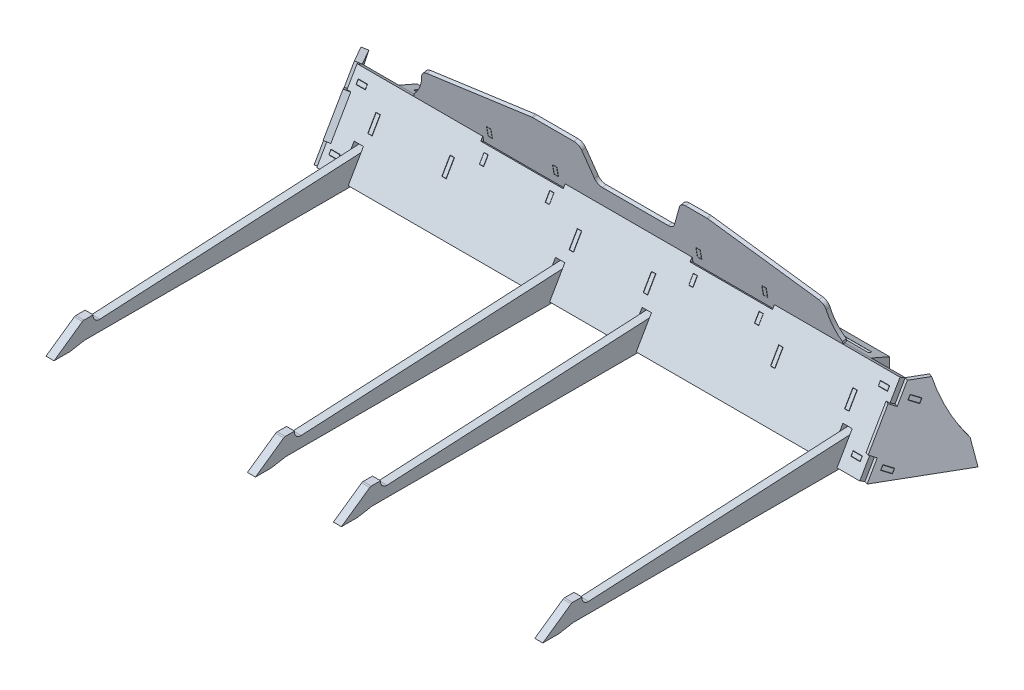
from build123d import *

# Parameters (mm, degrees)
BOSS_EXTRUDE1_DEPTH         = 214
SKETCH57_W                  = 3.02
SKETCH57_H                  = 31.755
SKETCH57_W_2                = 65
SKETCH57_H_2                = 3.02
CUT_EXTRUDE9_DEPTH          = 221.797815225
BOSS_EXTRUDE2_DEPTH         = 214
CUT_EXTRUDE1_DEPTH          = 236.113881398
BOSS_EXTRUDE31_REACH        = 224.119
SKETCH62_W                  = 64.6698
SKETCH62_H                  = 3.02
CUT_EXTRUDE11_DEPTH         = 281.495374193
CUT_EXTRUDE14_DEPTH         = 236.113881398
FILLET8_R                   = 6
BOSS_EXTRUDE4_DEPTH         = 27.5
CUT_EXTRUDE3_START          = 20.5
SKETCH1_10_W                = 3.175
SKETCH1_10_H                = 18
CUT_EXTRUDE3_DEPTH          = 15
CUT_EXTRUDE4_DEPTH          = 9
CUT_EXTRUDE4_DEPTH_BACK     = 198.869906117
CUT_EXTRUDE4_START          = -37.576497
SKETCH29_W                  = 41
SKETCH29_H                  = 3.175
BOSS_EXTRUDE13_DEPTH        = 3.02
ADVANCEDHOLE1_START         = -26.078544809
ADVANCEDHOLE1_OUTLINE_R     = 4.9022
ADVANCEDHOLE1_DEPTH         = 3.02
ADVANCEDHOLE1_START_2       = -32.928544809
ADVANCEDHOLE1_2_OUTLINE_R   = 4.1021
ADVANCEDHOLE1_2_DEPTH       = 23.233
ADVANCEDHOLE1_3_OUTLINE_R   = 4.9022
ADVANCEDHOLE1_3_OUTLINE_R_2 = 4.1021
ADVANCEDHOLE1_3_DEPTH       = 6.85
CUT_EXTRUDE5_START          = -10.025
CUT_EXTRUDE5_DEPTH          = 6.5
SKETCH35_R                  = 4.8125
CUT_EXTRUDE6_DEPTH          = 261.693802651
BOSS_EXTRUDE14_START        = 0.2
BOSS_EXTRUDE14_DEPTH        = 3.02
SKETCH37_R                  = 4.8025
CUT_EXTRUDE7_DEPTH          = 264.679515967
SKETCH72_W                  = 3.528
SKETCH72_H                  = 13.0302
CUT_EXTRUDE16_DEPTH         = 235.796866397
MIRROR22_COPY_1_SKETCH_W    = 3.528
MIRROR22_COPY_1_SKETCH_H    = 13.0302
MIRROR22_COPY_1_DEPTH       = 235.796866397
MIRROR23_COPY_1_SKETCH_W    = 3.528
MIRROR23_COPY_1_SKETCH_H    = 13.0302
MIRROR23_COPY_1_DEPTH       = 235.796866397
SKETCH53_R                  = 4.8025
BOSS_EXTRUDE20_DEPTH        = 6.35
SKETCH70_W                  = 7.35
SKETCH70_H                  = 24
CUT_EXTRUDE15_DEPTH         = 331.682625828
FILLET6_R                   = 5
FILLET6_R_2                 = 2
BOSS_EXTRUDE3_DEPTH         = 4.75
BOSS_EXTRUDE33_REACH        = 453.171
SKETCH64_W                  = 4.75
SKETCH64_H                  = 31.4248
CUT_EXTRUDE12_DEPTH         = 372.648131316
SKETCH39_W                  = 7
SKETCH39_H                  = 4.75
BOSS_EXTRUDE35_DEPTH        = 3.02
FILLET7_R                   = 25
CUT_EXTRUDE13_START         = -3.274
SKETCH68_W                  = 7.3302
SKETCH68_H                  = 5.0802
CUT_EXTRUDE13_DEPTH         = 3.528
MIRROR28_START              = -3.274
MIRROR28_COPY_1_SKETCH_W    = 7.3302
MIRROR28_COPY_1_SKETCH_H    = 5.0802
MIRROR28_COPY_1_DEPTH       = 3.528
BOSS_EXTRUDE38_DEPTH        = 3.02
FILLET9_R                   = 5
SKETCH74_W                  = 3.401
SKETCH74_H                  = 7.3302
CUT_EXTRUDE17_DEPTH         = 356.008620676
MIRROR33_COPY_1_SKETCH_W    = 3.401
MIRROR33_COPY_1_SKETCH_H    = 7.3302
MIRROR33_COPY_1_DEPTH       = 356.008620676
SKETCH75_W                  = 3.528
SKETCH75_H                  = 7.3302
CUT_EXTRUDE18_DEPTH         = 380.8760238
MIRROR35_COPY_1_SKETCH_W    = 3.528
MIRROR35_COPY_1_SKETCH_H    = 7.3302
MIRROR35_COPY_1_DEPTH       = 380.8760238


with BuildPart() as part:
    # Sketch1 → Boss-Extrude1 (new, symmetric)
    with BuildSketch(Plane(origin=(0, 0, 0), x_dir=(0, 0, -1), z_dir=(1, 0, 0))):
        Polygon((-14.318286676, -4.8), (17.43597813, 50.2), (13.322357462, 52.575), (-18.431907344, -2.425), align=None)
    extrude(amount=BOSS_EXTRUDE1_DEPTH, both=True)

    # Sketch57 → Cut-Extrude9 (cut, through all)
    with BuildSketch(Plane(origin=(0, 7.375, 12.773874706), x_dir=(1, 0, 0), z_dir=(0, 0.49999999999999756, 0.86602540378444))):
        with Locations((212.49, 20.438199529)):
            Rectangle(SKETCH57_W, SKETCH57_H)
        with Locations((82.5, 50.682464335)):
            Rectangle(SKETCH57_W_2, SKETCH57_H_2)
    cut_extrude9 = extrude(amount=-CUT_EXTRUDE9_DEPTH, mode=Mode.SUBTRACT)

    # Mirror18: Cut-Extrude9 across plane
    add(cut_extrude9.mirror(Plane(origin=(0, 0, 0), x_dir=(0, 0, 1), z_dir=(1, 0, 0))), mode=Mode.SUBTRACT)

    # Sketch72 → Cut-Extrude16 (cut, through all)
    with BuildSketch(Plane(origin=(0, 7.375, 12.773874706), x_dir=(1, 0, 0), z_dir=(0, 0.4999999999999976, 0.86602540378444))):
        with Locations((29.21, 26.891241941)):
            Rectangle(SKETCH72_W, SKETCH72_H)
    cut_extrude16 = extrude(amount=-CUT_EXTRUDE16_DEPTH, mode=Mode.SUBTRACT)

    # Mirror20: Cut-Extrude16 across plane
    add(cut_extrude16.mirror(Plane(origin=(0, 0, 0), x_dir=(0, 0, 1), z_dir=(1, 0, 0))), mode=Mode.SUBTRACT)

    # Mirror22: Cut-Extrude16 across plane
    add(cut_extrude16.mirror(Plane(origin=(-79.375, 0, 0), x_dir=(0, 0, 1), z_dir=(1, 0, 0))), mode=Mode.SUBTRACT)

    # Mirror22 copy 1 sketch → Mirror22 copy 1 (cut, through all)
    with BuildSketch(Plane(origin=(-158.75, 7.375, 12.773874706), x_dir=(1, 0, 0), z_dir=(0, 0.4999999999999976, 0.86602540378444))):
        with Locations((29.21, 26.891241941)):
            Rectangle(MIRROR22_COPY_1_SKETCH_W, MIRROR22_COPY_1_SKETCH_H)
    extrude(amount=-MIRROR22_COPY_1_DEPTH, mode=Mode.SUBTRACT)

    # Mirror23: Cut-Extrude16 across plane
    add(cut_extrude16.mirror(Plane(origin=(79.375, 0, 0), x_dir=(0, 0, 1), z_dir=(1, 0, 0))), mode=Mode.SUBTRACT)

    # Mirror23 copy 1 sketch → Mirror23 copy 1 (cut, through all)
    with BuildSketch(Plane(origin=(158.75, 7.375, 12.773874706), x_dir=(1, 0, 0), z_dir=(0, 0.4999999999999976, 0.86602540378444))):
        with Locations((29.21, 26.891241941)):
            Rectangle(MIRROR23_COPY_1_SKETCH_W, MIRROR23_COPY_1_SKETCH_H)
    extrude(amount=-MIRROR23_COPY_1_DEPTH, mode=Mode.SUBTRACT)

    # Sketch70 → Cut-Extrude15 (cut, through all)
    with BuildSketch(Plane(origin=(0, 7.375, 12.773874706), x_dir=(1, 0, 0), z_dir=(0, 0.4999999999999977, 0.8660254037844402))):
        with Locations((34.145, 0.683934724)):
            Rectangle(SKETCH70_W, SKETCH70_H)
    cut_extrude15 = extrude(amount=-CUT_EXTRUDE15_DEPTH, mode=Mode.SUBTRACT)

    # Mirror15: Cut-Extrude15 across plane
    add(cut_extrude15.mirror(Plane(origin=(0, 0, 0), x_dir=(0, 0, 1), z_dir=(1, 0, 0))), mode=Mode.SUBTRACT)

    # Mirror16: Cut-Extrude15 across plane
    add(cut_extrude15.mirror(Plane(origin=(-79.375, 0, 0), x_dir=(0, 0, 1), z_dir=(1, 0, 0))), mode=Mode.SUBTRACT)

    # Mirror17: Cut-Extrude15 across plane
    add(cut_extrude15.mirror(Plane(origin=(113.27, 0, 0), x_dir=(0, 0, 1), z_dir=(1, 0, 0))), mode=Mode.SUBTRACT)


with BuildPart() as body_2:
    # Sketch1<4> → Boss-Extrude2 (new body)
    with BuildSketch(Plane(origin=(0, 0, 0), x_dir=(0, 0, -1), z_dir=(1, 0, 0))):
        Polygon((13.322357462, 52.575), (16.296476876, 53.099417497), (9.350549769, 92.491727617), (6.376430355, 91.96731012), align=None)
    extrude(amount=BOSS_EXTRUDE2_DEPTH)

    # Sketch2 → Cut-Extrude1 (cut, through all)
    with BuildSketch(Plane(origin=(0, 3.863587535, -21.911493747), x_dir=(1, 0, 0), z_dir=(0, -0.17364817766693463, 0.9848077530122075))):
        with BuildLine():
            Line((214, 89.462864519), (69, 89.462864519))
            Line((69, 89.462864519), (159, 74.462864519))
            ThreePointArc((159, 74.462864519), (161.869136474, 62.036402117), (169, 51.462864519))
            Line((169, 51.462864519), (169, 49.462864519))
            Line((169, 49.462864519), (214, 49.462864519))
            Line((214, 49.462864519), (214, 89.462864519))
        make_face()
    extrude(amount=-CUT_EXTRUDE1_DEPTH, mode=Mode.SUBTRACT)

    # Boss-Extrude31: up to this plane
    boss_extrude31_end = Plane(origin=(50, 33.834603281, -39.741676734), z_dir=(0, -0.86602540378444, 0.49999999999999756))
    # Sketch62 → Boss-Extrude31 (add, up to the surface)
    with BuildSketch(Plane(origin=(0, 48.711412465, 8.589136286), x_dir=(1, 0, 0), z_dir=(0, -0.9848077530122064, -0.17364817766693993)), mode=Mode.PRIVATE) as boss_extrude31_sk1:
        with Locations((82.5, -23.759513857)):
            Rectangle(SKETCH62_W, SKETCH62_H)
    boss_extrude31_tool1 = split(extrude(boss_extrude31_sk1.sketch, amount=BOSS_EXTRUDE31_REACH, mode=Mode.PRIVATE), bisect_by=boss_extrude31_end, keep=Keep.BOTH, mode=Mode.PRIVATE)
    add(boss_extrude31_tool1.solids().sort_by_distance((82.5, 52.837209, -14.809417))[0])

    # Sketch63 → Cut-Extrude11 (cut, through all)
    with BuildSketch(Plane.ZY.offset(-50.1651)):
        Polygon((-17.421093826, 46.721397831), (-14.006935884, 48.692562837), (-16.981055298, 49.216980334), align=None)
    extrude(amount=-CUT_EXTRUDE11_DEPTH, mode=Mode.SUBTRACT)

    # Mirror24: body 2 across plane


with BuildPart() as body_2_1:
    add(body_2.part)
    add(body_2.part.mirror(Plane(origin=(0, 0, 0), x_dir=(0, 0, 1), z_dir=(1, 0, 0))))

    # Sketch69 → Cut-Extrude14 (cut, through all)
    with BuildSketch(Plane(origin=(0, 3.863587535, -21.911493747), x_dir=(1, 0, 0), z_dir=(0, -0.17364817766693463, 0.9848077530122074))):
        Polygon((-32.0575, 89.462864519), (-22.0575, 64.462864519), (37.9425, 64.462864519), (47.9425, 89.462864519), align=None)
    extrude(amount=-CUT_EXTRUDE14_DEPTH, mode=Mode.SUBTRACT)

    # Fillet8
    fillet8_edges = [body_2_1.edges().sort_by_distance(p)[0] for p in [
        (-32.0575, 92.229518869, -7.863490062),
        (47.9425, 92.229518869, -7.863490062),
        (37.9425, 67.609325043, -12.204694504),
        (-22.0575, 67.609325043, -12.204694504),
        (159, 77.457402574, -10.468212727),
        (69, 92.229518869, -7.863490062),
        (-69, 92.229518869, -7.863490062),
        (-159, 77.457402574, -10.468212727),
    ]]
    fillet(fillet8_edges, radius=FILLET8_R)

    # Sketch75 → Cut-Extrude18 (cut, through all)
    with BuildSketch(Plane(origin=(0, 3.863587535, -21.911493747), x_dir=(1, 0, 0), z_dir=(0, -0.17364817766693483, 0.9848077530122072))):
        with Locations((56.51, 55.799775636)):
            Rectangle(SKETCH75_W, SKETCH75_H)
    cut_extrude18 = extrude(amount=-CUT_EXTRUDE18_DEPTH, mode=Mode.SUBTRACT)

    # Mirror34: Cut-Extrude18 across plane
    add(cut_extrude18.mirror(Plane(origin=(82.5, 0, 0), x_dir=(0, 0, 1), z_dir=(1, 0, 0))), mode=Mode.SUBTRACT)

    # Mirror35: Cut-Extrude18 across plane
    add(cut_extrude18.mirror(Plane(origin=(0, 0, 0), x_dir=(0, 0, 1), z_dir=(1, 0, 0))), mode=Mode.SUBTRACT)

    # Mirror35 copy 1 sketch → Mirror35 copy 1 (cut, through all)
    with BuildSketch(Plane(origin=(-165, 3.863587535, -21.911493747), x_dir=(1, 0, 0), z_dir=(0, -0.17364817766693483, 0.9848077530122072))):
        with Locations((56.51, 55.799775636)):
            Rectangle(MIRROR35_COPY_1_SKETCH_W, MIRROR35_COPY_1_SKETCH_H)
    extrude(amount=-MIRROR35_COPY_1_DEPTH, mode=Mode.SUBTRACT)


with BuildPart() as body_3:
    # Sketch1<5> → Boss-Extrude4 (new, symmetric)
    with BuildSketch(Plane(origin=(0, 0, 0), x_dir=(0, 0, -1), z_dir=(1, 0, 0))):
        Polygon((-11.547005384, 0), (32.928544809, 0), (32.928544809, 42.876497308), (17.18597813, 49.766987298), align=None)
    extrude(amount=BOSS_EXTRUDE4_DEPTH, both=True)

    # Sketch1<10> → Cut-Extrude3 (cut)
    with BuildSketch(Plane(origin=(0, 0, 0), x_dir=(0, 0, -1), z_dir=(1, 0, 0)).offset(CUT_EXTRUDE3_START)):
        with Locations((24.491044809, 28.576497308)):
            Rectangle(SKETCH1_10_W, SKETCH1_10_H)
    cut_extrude3 = extrude(amount=-CUT_EXTRUDE3_DEPTH, mode=Mode.SUBTRACT)

    # Mirror3: Cut-Extrude3 across plane
    add(cut_extrude3.mirror(Plane(origin=(0, 0, 0), x_dir=(0, 0, 1), z_dir=(1, 0, 0))), mode=Mode.SUBTRACT)

    # Sketch29 → Cut-Extrude4 (cut, two sides: drawn at the far end of the back side and taken through both)
    with BuildSketch(Plane.XZ.offset(CUT_EXTRUDE4_START - CUT_EXTRUDE4_DEPTH_BACK)):
        with Locations((0, -24.491044809)):
            Rectangle(SKETCH29_W, SKETCH29_H)
    extrude(amount=CUT_EXTRUDE4_DEPTH + CUT_EXTRUDE4_DEPTH_BACK, mode=Mode.SUBTRACT)

    # AdvancedHole1 2 outline → AdvancedHole1 2 (cut)
    with BuildSketch(Plane.XY.offset(ADVANCEDHOLE1_START_2)):
        with Locations((-14.5, 29.1)):
            Circle(ADVANCEDHOLE1_2_OUTLINE_R)
        with Locations((14.5, 29.1)):
            Circle(ADVANCEDHOLE1_2_OUTLINE_R)
    extrude(amount=ADVANCEDHOLE1_2_DEPTH, mode=Mode.SUBTRACT)

    # AdvancedHole1 3 outline → AdvancedHole1 3 (cut)
    # profile 1 of 2: a face of its own
    with BuildSketch(Plane.XY.offset(ADVANCEDHOLE1_START_2)):
        with Locations((-14.5, 29.1)):
            Circle(ADVANCEDHOLE1_3_OUTLINE_R)
        with Locations((-14.5, 29.1)):
            Circle(ADVANCEDHOLE1_3_OUTLINE_R_2, mode=Mode.SUBTRACT)
    # profile 2 of 2: a face of its own
    with BuildSketch(Plane.XY.offset(ADVANCEDHOLE1_START_2)):
        with Locations((14.5, 29.1)):
            Circle(ADVANCEDHOLE1_3_OUTLINE_R)
        with Locations((14.5, 29.1)):
            Circle(ADVANCEDHOLE1_3_OUTLINE_R_2, mode=Mode.SUBTRACT)
    extrude(amount=ADVANCEDHOLE1_3_DEPTH, mode=Mode.SUBTRACT)

    # Sketch34 → Cut-Extrude5 (cut)
    with BuildSketch(Plane(origin=(0, 0, -32.928544809), x_dir=(-1, 0, 0), z_dir=(0, 0, -1)).offset(CUT_EXTRUDE5_START)):
        Polygon((-21.918950959, 29.1), (-18.20947548, 35.525), (-27.5, 35.525), (-27.5, 22.675), (-18.20947548, 22.675), align=None)
        Polygon((-10.79052452, 35.525), (-18.20947548, 35.525), (-21.918950959, 29.1), (-18.20947548, 22.675), (-10.79052452, 22.675), (-7.081049041, 29.1), align=None)
    cut_extrude5 = extrude(amount=-CUT_EXTRUDE5_DEPTH, mode=Mode.SUBTRACT)

    # Mirror4: Cut-Extrude5 across plane
    add(cut_extrude5.mirror(Plane(origin=(0, 0, 0), x_dir=(0, 0, 1), z_dir=(1, 0, 0))), mode=Mode.SUBTRACT)

    # Sketch35 → Cut-Extrude6 (cut, through all)
    with BuildSketch(Plane(origin=(27.5, 0, 0), x_dir=(0, 0, -1), z_dir=(1, 0, 0))):
        with Locations((9.928544809, 11)):
            Circle(SKETCH35_R)
    extrude(amount=-CUT_EXTRUDE6_DEPTH, mode=Mode.SUBTRACT)


with BuildPart() as body_4:
    # Sketch30 → Boss-Extrude13 (new body)
    with BuildSketch(Plane.XY.offset(-26.078544809)):
        Polygon((20.4, 19.676497308), (20.4, 45.774728625), (-20.4, 45.774728625), (-20.4, 19.676497308), (-5.6, 19.676497308), (-5.6, 28.676497308), (5.6, 28.676497308), (5.6, 19.676497308), align=None)
    extrude(amount=BOSS_EXTRUDE13_DEPTH)

    # AdvancedHole1: read off the stored shape, not the designer's step
    # AdvancedHole1 outline → AdvancedHole1 (cut)
    with BuildSketch(Plane.XY.offset(ADVANCEDHOLE1_START)):
        with Locations((-14.5, 29.1)):
            Circle(ADVANCEDHOLE1_OUTLINE_R)
        with Locations((14.5, 29.1)):
            Circle(ADVANCEDHOLE1_OUTLINE_R)
    extrude(amount=ADVANCEDHOLE1_DEPTH, mode=Mode.SUBTRACT)


with BuildPart() as body_5:
    # Sketch36 → Boss-Extrude14 (new body)
    with BuildSketch(Plane(origin=(27.5, 0, 0), x_dir=(0, 0, -1), z_dir=(1, 0, 0)).offset(BOSS_EXTRUDE14_START)):
        with BuildLine():
            Line((15.903544809, 21.545747629), (15.903544809, 47.545747629))
            Line((15.903544809, 47.545747629), (7.960366933, 33.787759974))
            Line((7.960366933, 33.787759974), (1.610366933, 22.789237346))
            Line((1.610366933, 22.789237346), (-11.547005384, 0))
            Line((-11.547005384, 0), (15.019067185, 0))
            ThreePointArc((15.019067185, 0), (22.039129295, 10.502846633), (15.903544809, 21.545747629))
        make_face()
        Polygon((1.610366933, 22.789237346), (7.960366933, 33.787759974), (3.846746265, 36.162759974), (-2.503253735, 25.164237346), align=None)
    extrude(amount=BOSS_EXTRUDE14_DEPTH)

    # Sketch37 → Cut-Extrude7 (cut, through all)
    with BuildSketch(Plane(origin=(30.72, 0, 0), x_dir=(0, 0, -1), z_dir=(1, 0, 0))):
        with Locations((9.928544809, 11)):
            Circle(SKETCH37_R)
    extrude(amount=-CUT_EXTRUDE7_DEPTH, mode=Mode.SUBTRACT)


with BuildPart() as body_6:
    # Mirror5: mirrored copy
    add(body_5.part.mirror(Plane(origin=(0, 0, 0), x_dir=(0, 0, 1), z_dir=(1, 0, 0))))


with BuildPart() as body_7:
    # Mirror6: mirrored copy
    add(body_4.part.mirror(Plane(origin=(79.375, 0, 0), x_dir=(0, 0, 1), z_dir=(1, 0, 0))))


with BuildPart() as body_8:
    # Mirror6 2: mirrored copy
    add(body_3.part.mirror(Plane(origin=(79.375, 0, 0), x_dir=(0, 0, 1), z_dir=(1, 0, 0))))


with BuildPart() as body_9:
    # Mirror6 3: mirrored copy
    add(body_5.part.mirror(Plane(origin=(79.375, 0, 0), x_dir=(0, 0, 1), z_dir=(1, 0, 0))))


with BuildPart() as body_10:
    # Mirror6 4: mirrored copy
    add(body_6.part.mirror(Plane(origin=(79.375, 0, 0), x_dir=(0, 0, 1), z_dir=(1, 0, 0))))


with BuildPart() as body_11:
    # Mirror7: mirrored copy
    add(body_3.part.mirror(Plane(origin=(-79.375, 0, 0), x_dir=(0, 0, 1), z_dir=(1, 0, 0))))


with BuildPart() as body_12:
    # Mirror7 2: mirrored copy
    add(body_5.part.mirror(Plane(origin=(-79.375, 0, 0), x_dir=(0, 0, 1), z_dir=(1, 0, 0))))


with BuildPart() as body_13:
    # Mirror7 3: mirrored copy
    add(body_6.part.mirror(Plane(origin=(-79.375, 0, 0), x_dir=(0, 0, 1), z_dir=(1, 0, 0))))


with BuildPart() as body_14:
    # Mirror7 4: mirrored copy
    add(body_4.part.mirror(Plane(origin=(-79.375, 0, 0), x_dir=(0, 0, 1), z_dir=(1, 0, 0))))


with BuildPart() as body_15:
    # Sketch53 → Boss-Extrude20 (new body)
    with BuildSketch(Plane(origin=(30.72, 0, 0), x_dir=(0, 0, -1), z_dir=(1, 0, 0))):
        with BuildLine():
            Line((-250.071455191, -6.3), (-237.371455191, -6.3))
            Line((-237.371455191, -6.3), (-226.028891552, -4.3))
            Line((-226.028891552, -4.3), (4.928544809, -4.3))
            Line((4.928544809, -4.3), (15.447100258, 2.660602794))
            ThreePointArc((15.447100258, 2.660602794), (19.923895617, 11.304897057), (14.928544809, 19.660254038))
            Line((14.928544809, 19.660254038), (4.451047289, 25.709440051))
            Line((4.451047289, 25.709440051), (-1.614033621, 15.204411763))
            Line((-1.614033621, 15.204411763), (-221.221087083, 3.7))
            Line((-221.221087083, 3.7), (-219.221087083, 9.7))
            Line((-219.221087083, 9.7), (-227.221087083, 9.7))
            Line((-227.221087083, 9.7), (-250.071455191, -6.3))
        make_face()
        with Locations((9.928544809, 11)):
            Circle(SKETCH53_R, mode=Mode.SUBTRACT)
    extrude(amount=BOSS_EXTRUDE20_DEPTH)

    # Fillet6
    # the kernel refuses this fillet: 5, 2 mm, written as the material it adds along each edge
    with BuildSketch(Plane(origin=(30.72, 3.7, 221.221087083), x_dir=(0, 0.052314613993120526, -0.9986306530258076), z_dir=(1, 0, 0))) as fillet6_piece_1:
        with BuildLine():
            CenterArc((7.231815262, 5), FILLET6_R, 169.779845169, 100.220154831)
            Line((2.31114899, 5.88715469), (0, 0))
            Line((0, 0), (7.231815262, 0))
        make_face()
    extrude(amount=6.35)
    # the kernel refuses this fillet: 5, 2 mm, written as the material it takes off along each edge
    with BuildSketch(Plane(origin=(29.143506056, 9.7, 227.221087083), x_dir=(0, 0, -1), z_dir=(1, 0, 0))) as fillet6_2_piece_1:
        with BuildLine():
            CenterArc((FILLET6_R_2 * 0.315298788879, -FILLET6_R_2), FILLET6_R_2, 90, 35)
            Line((-FILLET6_R_2 * 0.258277647472, -FILLET6_R_2 * 0.180847955711), (0, 0))
            Line((0, 0), (FILLET6_R_2 * 0.315298788879, 0))
        make_face()
    extrude(amount=9.502987889, mode=Mode.SUBTRACT)


with BuildPart() as body_16:
    # Mirror12: mirrored copy
    add(body_15.part.mirror(Plane(origin=(0, 0, 0), x_dir=(0, 0, 1), z_dir=(1, 0, 0))))


with BuildPart() as body_17:
    # Mirror13: mirrored copy
    add(body_16.part.mirror(Plane(origin=(79.375, 0, 0), x_dir=(0, 0, 1), z_dir=(1, 0, 0))))


with BuildPart() as body_18:
    # Mirror14: mirrored copy
    add(body_15.part.mirror(Plane(origin=(-79.375, 0, 0), x_dir=(0, 0, 1), z_dir=(1, 0, 0))))


with BuildPart() as body_19:
    # Sketch4 → Boss-Extrude3 (new body)
    with BuildSketch(Plane(origin=(152.769230769, 50.923076923, 88.201356509), x_dir=(-0.4557327151876485, -0.15191090506254756, 0.8770580193070305), z_dir=(-0.8320502943378459, -0.2773500981126118, -0.4803844614152592))):
        with BuildLine():
            Line((-147.43459706, -82.345710271), (-84.239660554, -72.226421758))
            Line((-84.239660554, -72.226421758), (-120.445092927, -20.048840365))
            Line((-120.445092927, -20.048840365), (-134.268985288, -22.262434728))
            ThreePointArc((-134.268985288, -22.262434728), (-138.378315622, -43.958635495), (-147.149107364, -64.223998451))
            Line((-147.149107364, -64.223998451), (-147.43459706, -82.345710271))
        make_face()
    extrude(amount=-BOSS_EXTRUDE3_DEPTH)

    # Boss-Extrude33: up to this plane
    boss_extrude33_end = Plane(origin=(210.98, -8.75, -15.155444566), z_dir=(-1, 0, 0))
    # Sketch64 → Boss-Extrude33 (add, up to the surface)
    with BuildSketch(Plane(origin=(61.230769231, -45.923076923, -79.541102471), x_dir=(0.8320502943378459, 0.27735009811261185, 0.48038446141525915), z_dir=(-0.5547001962252258, 0.41602514716892147, 0.720576692122895)), mode=Mode.PRIVATE) as boss_extrude33_sk1:
        with Locations((185.980764951, 20.438199529)):
            Rectangle(SKETCH64_W, SKETCH64_H)
    boss_extrude33_tool1 = split(extrude(boss_extrude33_sk1.sketch, amount=BOSS_EXTRUDE33_REACH, mode=Mode.PRIVATE), bisect_by=boss_extrude33_end, keep=Keep.BOTH, mode=Mode.PRIVATE)
    add(boss_extrude33_tool1.solids().sort_by_distance((215.976119, 23.358706, -0.417933))[0])

    # Sketch66 → Cut-Extrude12 (cut, through all)
    with BuildSketch(Plane(origin=(0, 31.307337554, -18.075299765), x_dir=(1, 0, 0), z_dir=(0, 0.8660254037844398, -0.49999999999999817))):
        Polygon((214.830700437, -17.317133624), (210.98, -14.75), (210.98, -23.093184279), align=None)
    extrude(amount=-CUT_EXTRUDE12_DEPTH, mode=Mode.SUBTRACT)


with BuildPart() as body_20:
    # Sketch39 → Boss-Extrude35 (new body)
    with BuildSketch(Plane(origin=(0, -1.139745962, 0.658032638), x_dir=(-1, 0, 0), z_dir=(0, -0.86602540378444, 0.4999999999999976))):
        Polygon((-198.800791567, -10), (-198.800791567, -6.825), (-212.300791567, -6.825), (-214, -10), (-209.300791567, -10), (-202.300791567, -10), align=None)
        Polygon((-214, -10), (-212.300791567, -6.825), (-219.789244216, 4.407678974), (-222.4310039, 2.646505851), (-220.489553214, -0.26567018), (-216.60665184, -6.09002224), align=None)
        with Locations((-205.800791567, -12.375)):
            Rectangle(SKETCH39_W, SKETCH39_H)
        Polygon((-220.558890738, -8.724848172), (-216.60665184, -6.09002224), (-220.489553214, -0.26567018), (-224.441792112, -2.900496112), align=None)
    extrude(amount=-BOSS_EXTRUDE35_DEPTH)

    # Fillet7
    fillet7_edges = [body_20.edges().sort_by_distance(p)[0] for p in [
        (212.300791567, 3.580452398, 5.813656019),
    ]]
    fillet(fillet7_edges, radius=FILLET7_R)


with BuildPart() as body_21:
    # Mirror2: mirrored copy
    add(body_19.part.mirror(Plane(origin=(0, 0, 0), x_dir=(0, 0, 1), z_dir=(1, 0, 0))))


with BuildPart() as body_22:
    # Mirror25: mirrored copy
    add(body_20.part.mirror(Plane(origin=(0, 18.796158833, -10.851967362), x_dir=(0, 0.49999999999999784, 0.8660254037844399), z_dir=(0, 0.8660254037844402, -0.4999999999999977))))


with BuildPart() as cut_extrude13_tool:
    # Sketch68 → Cut-Extrude13 (new body)
    with BuildSketch(Plane(origin=(0, -1.139745962, 0.658032638), x_dir=(1, 0, 0), z_dir=(0, -0.8660254037844402, 0.4999999999999977)).offset(CUT_EXTRUDE13_START)):
        with Locations((205.800791567, 12.375)):
            Rectangle(SKETCH68_W, SKETCH68_H)
        Polygon((224.670744618, 2.854705611), (220.443762712, 0.036717674), (216.377699334, 6.135812741), (220.604681239, 8.953800678), align=None)
    cut_extrude13 = extrude(amount=CUT_EXTRUDE13_DEPTH)


with BuildPart() as part_1:
    add(part.part)

    # Cut-Extrude13: cut by cut_extrude13_tool
    add(cut_extrude13_tool.part, mode=Mode.SUBTRACT)


with BuildPart() as body_19_1:
    add(body_19.part)

    # Cut-Extrude13: cut by cut_extrude13_tool
    add(cut_extrude13_tool.part, mode=Mode.SUBTRACT)


with BuildPart() as mirror26_tool:
    # Mirror26: Cut-Extrude13 across plane
    add(cut_extrude13.mirror(Plane(origin=(0, 18.796158833, -10.851967362), x_dir=(0, 0.49999999999999784, 0.8660254037844399), z_dir=(0, 0.8660254037844402, -0.4999999999999977))))


with BuildPart() as part_2:
    add(part_1.part)

    # Mirror26: cut by mirror26_tool
    add(mirror26_tool.part, mode=Mode.SUBTRACT)


with BuildPart() as body_19_2:
    add(body_19_1.part)

    # Mirror26: cut by mirror26_tool
    add(mirror26_tool.part, mode=Mode.SUBTRACT)


with BuildPart() as mirror28_tool:
    # Mirror28: Cut-Extrude13 across plane
    add(cut_extrude13.mirror(Plane(origin=(0, 0, 0), x_dir=(0, 0, 1), z_dir=(1, 0, 0))))


with BuildPart() as part_3:
    add(part_2.part)

    # Mirror28: cut by mirror28_tool
    add(mirror28_tool.part, mode=Mode.SUBTRACT)


with BuildPart() as body_21_1:
    add(body_21.part)

    # Mirror28: cut by mirror28_tool
    add(mirror28_tool.part, mode=Mode.SUBTRACT)


with BuildPart() as mirror28_copy_1_tool:
    # Mirror28 copy 1 sketch → Mirror28 copy 1 (new body)
    with BuildSketch(Plane(origin=(0, 38.732063628, -22.361967362), x_dir=(-1, 0, 0), z_dir=(0, 0.8660254037844406, -0.499999999999998)).offset(MIRROR28_START)):
        with Locations((205.800791567, 12.375)):
            Rectangle(MIRROR28_COPY_1_SKETCH_W, MIRROR28_COPY_1_SKETCH_H)
        Polygon((224.670744618, 2.854705611), (220.443762712, 0.036717674), (216.377699334, 6.135812741), (220.604681239, 8.953800678), align=None)
    extrude(amount=MIRROR28_COPY_1_DEPTH)


with BuildPart() as part_4:
    add(part_3.part)

    # Mirror28 copy 1: cut by mirror28_copy_1_tool
    add(mirror28_copy_1_tool.part, mode=Mode.SUBTRACT)

    # Sketch74 → Cut-Extrude17 (cut, through all)
    with BuildSketch(Plane(origin=(0, 7.375, 12.773874706), x_dir=(1, 0, 0), z_dir=(0, 0.4999999999999976, 0.86602540378444))):
        with Locations((56.5735, 40.848159589)):
            Rectangle(SKETCH74_W, SKETCH74_H)
    cut_extrude17 = extrude(amount=-CUT_EXTRUDE17_DEPTH, mode=Mode.SUBTRACT)

    # Mirror32: Cut-Extrude17 across plane
    add(cut_extrude17.mirror(Plane(origin=(82.5, 0, 0), x_dir=(0, 0, 1), z_dir=(1, 0, 0))), mode=Mode.SUBTRACT)

    # Mirror33: Cut-Extrude17 across plane
    add(cut_extrude17.mirror(Plane(origin=(0, 0, 0), x_dir=(0, 0, 1), z_dir=(1, 0, 0))), mode=Mode.SUBTRACT)

    # Mirror33 copy 1 sketch → Mirror33 copy 1 (cut, through all)
    with BuildSketch(Plane(origin=(-165, 7.375, 12.773874706), x_dir=(1, 0, 0), z_dir=(0, 0.4999999999999976, 0.86602540378444))):
        with Locations((56.5735, 40.848159589)):
            Rectangle(MIRROR33_COPY_1_SKETCH_W, MIRROR33_COPY_1_SKETCH_H)
    extrude(amount=-MIRROR33_COPY_1_DEPTH, mode=Mode.SUBTRACT)


with BuildPart() as body_21_2:
    add(body_21_1.part)

    # Mirror28 copy 1: cut by mirror28_copy_1_tool
    add(mirror28_copy_1_tool.part, mode=Mode.SUBTRACT)


with BuildPart() as body_23:
    # Mirror29: mirrored copy
    add(body_22.part.mirror(Plane(origin=(0, 0, 0), x_dir=(0, 0, 1), z_dir=(1, 0, 0))))


with BuildPart() as body_24:
    # Mirror29 2: mirrored copy
    add(body_20.part.mirror(Plane(origin=(0, 0, 0), x_dir=(0, 0, 1), z_dir=(1, 0, 0))))


with BuildPart() as body_25:
    # Sketch71 → Boss-Extrude38 (new body)
    with BuildSketch(Plane(origin=(55, 0, 0), x_dir=(0, 0, -1), z_dir=(1, 0, 0))):
        Polygon((22.889901816, 48.175091268), (17.372707486, 65.308700541), (14.241018831, 64.756499336), (16.981055298, 49.216980334), (15.92597813, 47.584603281), (9.013825756, 35.612404181), (11.767786541, 34.022404181), align=None)
        Polygon((14.588315186, 62.78688383), (11.614195772, 62.262466333), (12.829733016, 55.368812062), (15.80385243, 55.893229559), align=None)
        Polygon((10.013825756, 37.344454988), (13.513825756, 43.406632815), (9.400205088, 45.781632815), (5.900205088, 39.719454988), align=None)
        Polygon((16.981055298, 49.216980334), (22.889901816, 48.175091268), (11.767786541, 34.022404181), (9.013825756, 35.612404181), (15.92597813, 47.584603281), align=None)
    extrude(amount=BOSS_EXTRUDE38_DEPTH)

    # Fillet9
    fillet9_edges = [body_25.edges().sort_by_distance(p)[0] for p in [
        (56.51, 48.175091268, -22.889901816),
    ]]
    fillet(fillet9_edges, radius=FILLET9_R)


with BuildPart() as body_26:
    # Mirror30: mirrored copy
    add(body_25.part.mirror(Plane(origin=(82.5, 0, 0), x_dir=(0, 0, 1), z_dir=(1, 0, 0))))


with BuildPart() as body_27:
    # Mirror31: mirrored copy
    add(body_25.part.mirror(Plane(origin=(0, 0, 0), x_dir=(0, 0, 1), z_dir=(1, 0, 0))))


with BuildPart() as body_28:
    # Mirror31 2: mirrored copy
    add(body_26.part.mirror(Plane(origin=(0, 0, 0), x_dir=(0, 0, 1), z_dir=(1, 0, 0))))


solid = Compound([body_2_1.part, body_3.part, body_4.part, body_5.part, body_6.part, body_7.part, body_8.part, body_9.part, body_10.part, body_11.part, body_12.part, body_13.part, body_14.part, body_15.part, body_16.part, body_17.part, body_18.part, body_20.part, body_22.part, body_19_2.part, part_4.part, body_21_2.part, body_23.part, body_24.part, body_25.part, body_26.part, body_27.part, body_28.part])
